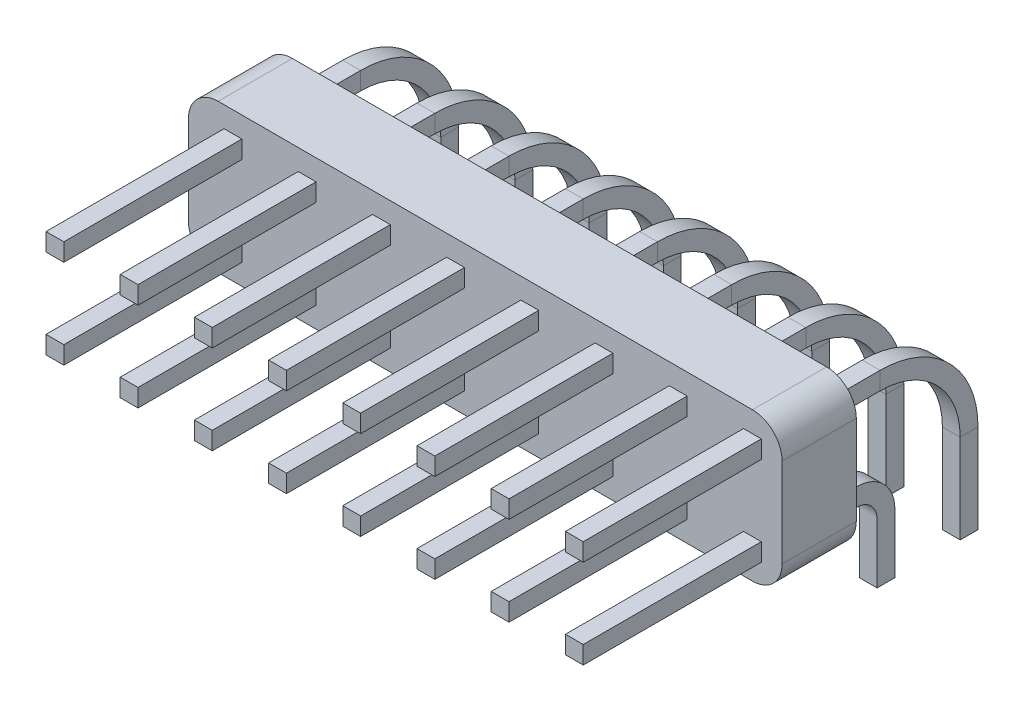
from build123d import *

# Parameters (mm, degrees)
SKETCH_1_W             = 20
SKETCH_1_H             = 2.5
EXTRUDE_1_DEPTH        = 5
SKETCH_4_W             = 0.6
SKETCH_4_H             = 0.6
SWEEP_START            = 8.7
SWEEP_2_OUTLINE_W      = 0.6
SWEEP_2_OUTLINE_H      = 6
SWEEP_2_DEPTH          = 0.6
PATTERN_LINEAR_1_COUNT = 8
PATTERN_LINEAR_1_PITCH = 2.5
FILLET_1_R             = 1


# Read off the part's stored shape, not the designer's step: 扫描2
with BuildPart() as part:
    # 草图1 → 凸台-拉伸1 (new body)
    with BuildSketch(Plane(origin=(0, 0, 0), x_dir=(1, 0, 0), z_dir=(0, 1, 0))):
        Rectangle(SKETCH_1_W, SKETCH_1_H)
    extrude(amount=EXTRUDE_1_DEPTH)

    # 扫描1: sweep along a path in 草图3
    with BuildLine(Plane(origin=(9, 0, 0), x_dir=(0, 0, -1), z_dir=(1, 0, 0))) as sweep_1_path:
        Line((-7.25, 4), (2.75, 4))
        ThreePointArc((2.75, 4), (4.871320344, 3.121320344), (5.75, 1))
        Line((5.75, 1), (5.75, -2))
    # 草图4 → 扫描1 (sweep)
    with BuildSketch(Plane(origin=(0, 0, 0), x_dir=(-1, 0, 0), z_dir=(0, -1, 0))):
        with Locations((-9, 5.75)):
            Rectangle(SKETCH_4_W, SKETCH_4_H)
    sweep_1 = sweep(path=sweep_1_path.line)

    # 扫描2 outline → 扫描2 (add)
    with BuildSketch(Plane.YZ.offset(SWEEP_START)):
        with BuildLine():
            add(Edge.make_bspline(
                [(-2, -2.65), (-1.666666667, -2.65), (-1.333333333, -2.65), (-0.833333333, -2.65), (-0.666666667, -2.65), (-0.416666667, -2.65), (-0.333333333, -2.65), (-0.166666667, -2.65), (-0.070833101, -2.650014583), (0.111264375, -2.649977093), (0.183157098, -2.631808386), (0.352599708, -2.561622959), (0.43018322, -2.509766273), (0.6245578, -2.315391694), (0.7, -2.133723022), (0.7, -1.95)],
                knots=[0, 0, 0, 0, 0.078303653, 0.078303653, 0.117455479, 0.117455479, 0.137031392, 0.137031392, 0.156607305, 0.156607305, 0.187357078, 0.187357078, 0.21810685, 0.21810685, 0.279606395, 0.279606395, 0.279606395, 0.279606395], degree=3))
            Line((-2, -2.65), (-2, -3.25))
            add(Edge.make_bspline(
                [(-2, -3.25), (-1.666666667, -3.25), (-1.333333333, -3.25), (-0.833333333, -3.25), (-0.666666667, -3.25), (-0.416666667, -3.25), (-0.333333333, -3.25), (-0.166666667, -3.25), (-0.095832902, -3.250027083), (0.15053397, -3.249957458), (0.340148895, -3.216215575), (0.654828029, -3.08587121), (0.798911695, -2.989565936), (1.159893057, -2.628584574), (1.3, -2.291199898), (1.3, -1.95)],
                knots=[0, 0, 0, 0, 0.078303653, 0.078303653, 0.117455479, 0.117455479, 0.137031392, 0.137031392, 0.156607305, 0.156607305, 0.187357078, 0.187357078, 0.21810685, 0.21810685, 0.279606395, 0.279606395, 0.279606395, 0.279606395], degree=3))
            Line((1.3, -1.95), (1.3, -1.25))
            Line((1.3, -1.25), (0.7, -1.25))
            Line((0.7, -1.25), (0.7, -1.95))
        make_face()
        with Locations((1, 4.25)):
            Rectangle(SWEEP_2_OUTLINE_W, SWEEP_2_OUTLINE_H)
    sweep_2 = extrude(amount=SWEEP_2_DEPTH)

    # 阵列(线性)1: 扫描1, 扫描2 ×8
    with Locations(*[(-i * PATTERN_LINEAR_1_PITCH, 0, 0) for i in range(1, PATTERN_LINEAR_1_COUNT)]):
        add(sweep_1)
        add(sweep_2)

    # 圆角1
    fillet_1_edges = [part.edges().sort_by_distance(p)[0] for p in [
        (-10, 5, 0),
        (10, 5, 0),
        (-10, 0, 0),
        (10, 0, 0),
    ]]
    fillet(fillet_1_edges, radius=FILLET_1_R)


solid = part.part
